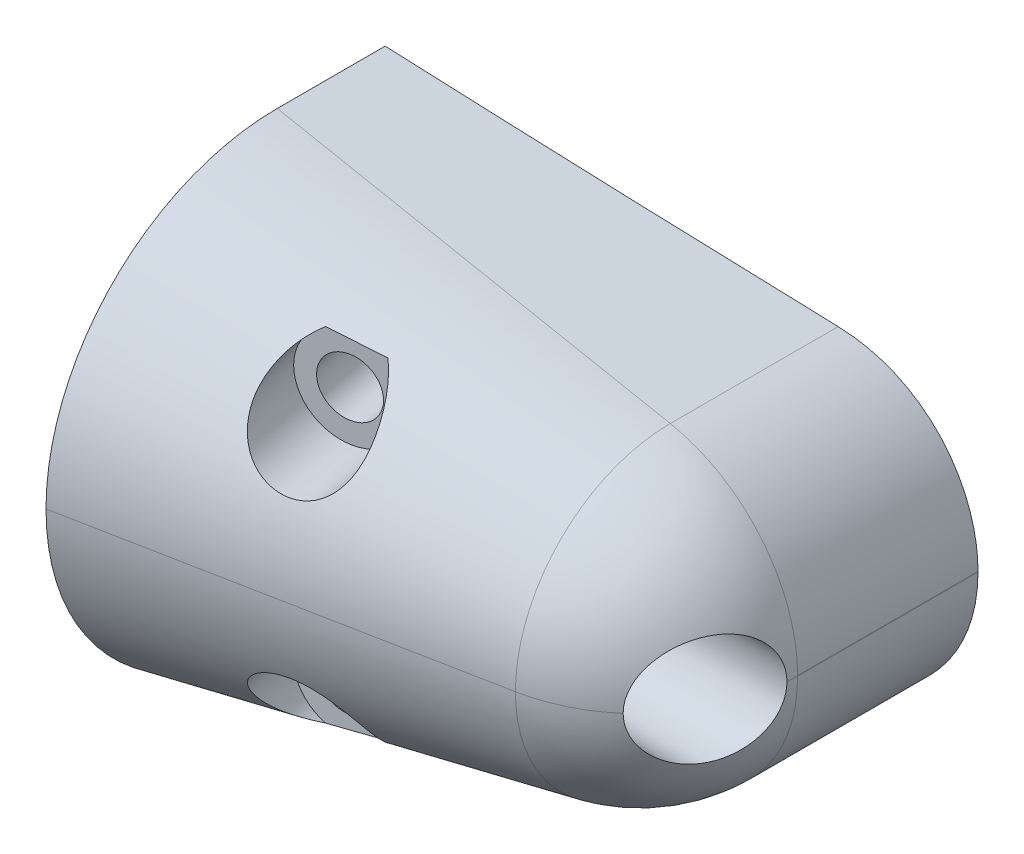
from build123d import *

# Parameters (mm, degrees)
ESQUISSE1_W                  = 20
ESQUISSE1_H                  = 18
BOSS_EXTRU_1_DEPTH           = 17
ENL_V_MAT_EXTRU_1_DEPTH      = 32.827660926
ENL_V_MAT_EXTRU_1_DEPTH_BACK = 32.827660926
ESQUISSE4_W                  = 22.812140382
ESQUISSE4_H                  = 17.8
ENL_V_MAT_EXTRU_3_DEPTH      = 1
CONG_2_R                     = 40
ESQUISSE5_R                  = 2.1
ENL_V_MAT_EXTRU_4_DEPTH      = 29.861739379
CONG_3_R                     = 9
CHANFREIN1_SIZE              = 20.578216064
CHANFREIN1_SIZE_2            = 4
CONG_4_R                     = 6.05
ESQUISSE6_R                  = 1.1
ENL_V_MAT_EXTRU_5_DEPTH      = 252.816113418
ESQUISSE10_R                 = 1.9
ENL_V_MAT_EXTRU_6_DEPTH      = 7.5


# Some blends are built 0.0001 mm under size
with BuildPart() as part:
    # Esquisse1 → Boss.-Extru.1 (new body)
    with BuildSketch(Plane.XY):
        with Locations((10, 3)):
            Rectangle(ESQUISSE1_W, ESQUISSE1_H)
    extrude(amount=BOSS_EXTRU_1_DEPTH)

    # Esquisse2 → Enlèv. mat.-Extru.1 (cut, two sides: drawn at the far end of the back side and taken through both)
    with BuildSketch(Plane(origin=(0, 12, 0), x_dir=(1, 0, 0), z_dir=(0, 1, 0)).offset(-ENL_V_MAT_EXTRU_1_DEPTH_BACK)):
        Polygon((81.461522254, 11.626508335), (20.045630921, -0.0408989), (0, -3.849042594), (0, 0), (0, 62.514319158), (66.24104297, 168.553390377), (147.702565224, 117.665579555), align=None)
    extrude(amount=ENL_V_MAT_EXTRU_1_DEPTH + ENL_V_MAT_EXTRU_1_DEPTH_BACK, mode=Mode.SUBTRACT)

    # Esquisse4 → Enlèv. mat.-Extru.3 (cut)
    with BuildSketch(Plane(origin=(0.705746644, 0, 3.714969257), x_dir=(-0.9824291803850712, 0, 0.1866357562952965), z_dir=(-0.1866357562952965, 0, -0.9824291803850712))):
        with Locations((-8.233262334, 3)):
            Rectangle(ESQUISSE4_W, ESQUISSE4_H)
    extrude(amount=-ENL_V_MAT_EXTRU_3_DEPTH, mode=Mode.SUBTRACT)

    # Congé2
    # the kernel refuses this fillet: 40 mm, written as the material it adds along each edge
    with BuildSketch(Plane(origin=(41.830053891, 11.9, -3.079684565), x_dir=(0, -1, 0), z_dir=(-0.9824291803850712, 0, 0.1866357562952965))) as cong_2_piece_1_section:
        with BuildLine():
            CenterArc((8.888194417, -40), CONG_2_R, 90, 12.838568141)
            Line((0, -1), (0, 0))
            Line((0, 0), (8.888194417, 0))
        make_face()
    cong_2_piece_1 = extrude(amount=64.798673587, mode=Mode.PRIVATE)
    cong_2_piece_1 = split(cong_2_piece_1, bisect_by=Plane(origin=(20, 11.9, -3.079684565), z_dir=(-1, 0, 0)), keep=Keep.TOP, mode=Mode.PRIVATE)
    cong_2_piece_1 = split(cong_2_piece_1, bisect_by=Plane(origin=(0, 11.9, -3.079684565), z_dir=(1, 0, 0)), keep=Keep.TOP, mode=Mode.PRIVATE)
    add(cong_2_piece_1)
    with BuildSketch(Plane(origin=(-21.830053891, -5.9, 9.014064887), x_dir=(-0.1866357562952965, 0, -0.9824291803850712), z_dir=(0.9824291803850712, 0, -0.1866357562952965))) as cong_2_piece_2_section:
        with BuildLine():
            CenterArc((40, 8.888194417), CONG_2_R, 180, 12.838568141)
            Line((0, 8.888194417), (0, 0))
            Line((0, 0), (1, 0))
        make_face()
    cong_2_piece_2 = extrude(amount=64.798673587, mode=Mode.PRIVATE)
    cong_2_piece_2 = split(cong_2_piece_2, bisect_by=Plane(origin=(20, -5.9, 9.014064887), z_dir=(-1, 0, 0)), keep=Keep.TOP, mode=Mode.PRIVATE)
    cong_2_piece_2 = split(cong_2_piece_2, bisect_by=Plane(origin=(0, -5.9, 9.014064887), z_dir=(1, 0, 0)), keep=Keep.TOP, mode=Mode.PRIVATE)
    add(cong_2_piece_2)

    # Esquisse5 → Enlèv. mat.-Extru.4 (cut, through all)
    with BuildSketch(Plane.ZY):
        with Locations((10.5, 3)):
            Circle(ESQUISSE5_R)
    extrude(amount=-ENL_V_MAT_EXTRU_4_DEPTH, mode=Mode.SUBTRACT)

    # Congé3
    cong_3_edges = [part.edges().sort_by_distance(p)[0] for p in [
        (10, 12, 17),
        (10, -6, 17),
    ]]
    fillet(cong_3_edges, radius=CONG_3_R - 0.0001)  # a hair under: the kernel refuses the full size

    # Chanfrein1
    # the kernel refuses this chamfer: 20.578216064, 4 mm, written as the material it takes off along each edge
    with BuildSketch(Plane(origin=(20, -6, -53.417428004), x_dir=(-1, 0, 0), z_dir=(0, 0, 1))) as chanfrein1_piece_1:
        Polygon((CHANFREIN1_SIZE, 0), (0, -CHANFREIN1_SIZE_2), (0, 0), align=None)
    extrude(amount=61.417528004, mode=Mode.SUBTRACT)
    with BuildSketch(Plane(origin=(20, 2.9999, 8.0001), x_dir=(0, -1, 0), z_dir=(0, 0, -1))) as chanfrein1_piece_2:
        Polygon((8.9999, CHANFREIN1_SIZE), (8.9999 - CHANFREIN1_SIZE_2, 0), (8.9999, 0), align=None)
    revolve(axis=Axis((20, 2.9999, 8.0001), (-1, 0, 0)), revolution_arc=90, mode=Mode.SUBTRACT)
    with BuildSketch(Plane(origin=(20, 3.0001, 8.0001), x_dir=(0, 0, 1), z_dir=(0, -1, 0))) as chanfrein1_piece_3:
        Polygon((8.9999, CHANFREIN1_SIZE), (8.9999 - CHANFREIN1_SIZE_2, 0), (8.9999, 0), align=None)
    revolve(axis=Axis((20, 3.0001, 8.0001), (-1, 0, 0)), revolution_arc=90, mode=Mode.SUBTRACT)
    with BuildSketch(Plane(origin=(20, 12, -53.417428004), x_dir=(-1, 0, 0), z_dir=(0, 0, 1))) as chanfrein1_piece_4:
        Polygon((CHANFREIN1_SIZE, 0), (0, CHANFREIN1_SIZE_2), (0, 0), align=None)
    extrude(amount=61.417528004, mode=Mode.SUBTRACT)
    with BuildSketch(Plane(origin=(20, 2.9999, 17), x_dir=(-1, 0, 0), z_dir=(0, 1, 0))) as chanfrein1_piece_5:
        Polygon((CHANFREIN1_SIZE, 0), (0, -CHANFREIN1_SIZE_2), (0, 0), align=None)
    extrude(amount=0.0002, mode=Mode.SUBTRACT)

    # Congé4
    # the kernel refuses this fillet: 6.05 mm, written as the material it takes off along each edge
    with BuildSketch(Plane(origin=(20, -2, -11.718464458), x_dir=(-0.9816271834478701, -0.1908089953754837, 0), z_dir=(0, 0, 1))) as cong_4_piece_1:
        with BuildLine():
            CenterArc((CONG_4_R * 0.824336385818, -CONG_4_R), CONG_4_R, 90, 79)
            Line((-CONG_4_R * 0.157290797629, -CONG_4_R * 0.809191004625), (0, 0))
            Line((0, 0), (CONG_4_R * 0.824336385818, 0))
        make_face()
    extrude(amount=19.718564458, mode=Mode.SUBTRACT)
    with BuildSketch(Plane(origin=(20, 2.9999, 8.0001), x_dir=(0, -1, 0), z_dir=(0, 0, -1))) as cong_4_piece_2:
        with BuildLine():
            CenterArc((4.9999 - CONG_4_R * 0.824336385818, CONG_4_R), CONG_4_R, 270, 79)
            Line((4.9999 - CONG_4_R * 0.824336385818, 0), (4.9999, 0))
            Line((4.9999, 0), (4.9999 + CONG_4_R * 0.157290797629, CONG_4_R * 0.809191004625))
        make_face()
    revolve(axis=Axis((20, 2.9999, 8.0001), (-1, 0, 0)), revolution_arc=90, mode=Mode.SUBTRACT)
    with BuildSketch(Plane(origin=(20, 3.0001, 8.0001), x_dir=(0, 0, 1), z_dir=(0, -1, 0))) as cong_4_piece_3:
        with BuildLine():
            CenterArc((4.9999 - CONG_4_R * 0.824336385818, CONG_4_R), CONG_4_R, 270, 79)
            Line((4.9999 - CONG_4_R * 0.824336385818, 0), (4.9999, 0))
            Line((4.9999, 0), (4.9999 + CONG_4_R * 0.157290797629, CONG_4_R * 0.809191004625))
        make_face()
    revolve(axis=Axis((20, 3.0001, 8.0001), (-1, 0, 0)), revolution_arc=90, mode=Mode.SUBTRACT)
    with BuildSketch(Plane(origin=(20, 8, -11.718464458), x_dir=(-0.9816271834478701, 0.1908089953754837, 0), z_dir=(0, 0, 1))) as cong_4_piece_4:
        with BuildLine():
            CenterArc((CONG_4_R * 0.824336385818, CONG_4_R), CONG_4_R, 191, 79)
            Line((-CONG_4_R * 0.157290797629, CONG_4_R * 0.809191004625), (0, 0))
            Line((0, 0), (CONG_4_R * 0.824336385818, 0))
        make_face()
    extrude(amount=19.718564458, mode=Mode.SUBTRACT)
    with BuildSketch(Plane(origin=(20, 2.9999, 13), x_dir=(-0.9816271834478701, 0, 0.1908089953754837), z_dir=(0, 1, 0))) as cong_4_piece_5:
        with BuildLine():
            CenterArc((CONG_4_R * 0.824336385818, -CONG_4_R), CONG_4_R, 90, 79)
            Line((-CONG_4_R * 0.157290797629, -CONG_4_R * 0.809191004625), (0, 0))
            Line((0, 0), (CONG_4_R * 0.824336385818, 0))
        make_face()
    extrude(amount=0.0002, mode=Mode.SUBTRACT)

    # Esquisse6 → Enlèv. mat.-Extru.5 (cut, through all)
    with BuildSketch(Plane(origin=(247.804103642, 0, -26.276800017), x_dir=(-0.9824291803850712, 0, 0.1866357562952965), z_dir=(-0.1866357562952965, 0, -0.9824291803850712))):
        with Locations(Location((244, 7.9, 0), (0, 0, 180))):
            Circle(ESQUISSE6_R)
        with Locations(Location((244, -1.9, 0), (0, 0, 180))):
            Circle(ESQUISSE6_R)
    extrude(amount=ENL_V_MAT_EXTRU_5_DEPTH, mode=Mode.SUBTRACT)

    # Esquisse10 → Enlèv. mat.-Extru.6 (cut)
    with BuildSketch(Plane(origin=(3.813717133, 0, 20.074968868), x_dir=(-0.9824291803850712, 0, 0.1866357562952965), z_dir=(-0.1866357562952965, 0, -0.9824291803850712))):
        with Locations((-4.4, 7.9)):
            Circle(ESQUISSE10_R)
        with Locations((-4.4, -1.9)):
            Circle(ESQUISSE10_R)
    extrude(amount=ENL_V_MAT_EXTRU_6_DEPTH, mode=Mode.SUBTRACT)


solid = part.part
